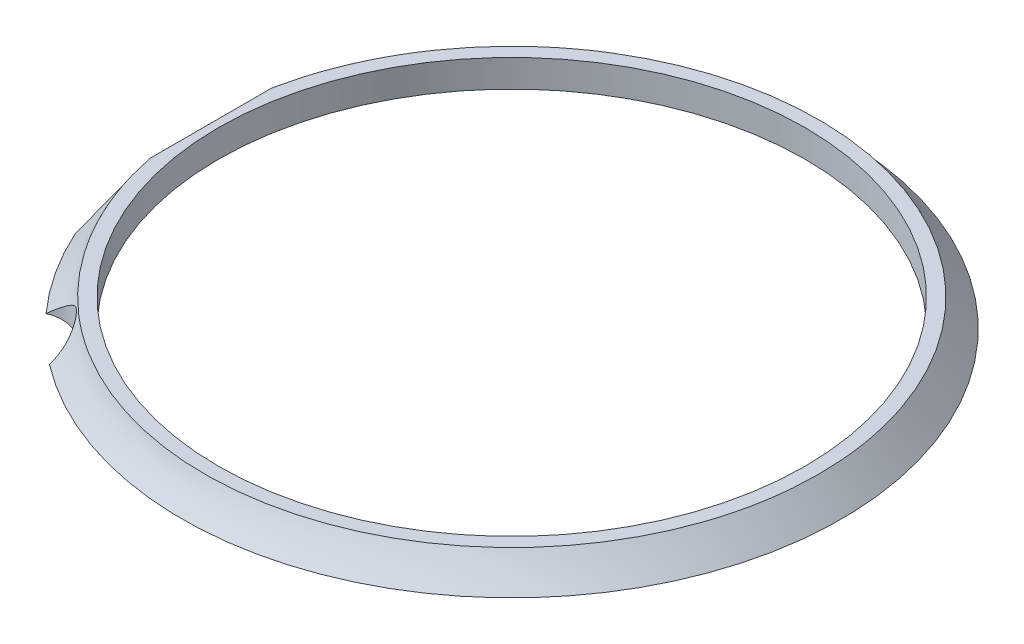
from build123d import *

# Parameters (mm, degrees)
SKETCH4_R          = 40.767
CUT_EXTRUDE2_DEPTH = 65.949295124
SKETCH5_R          = 4.75
CUT_EXTRUDE3_DEPTH = 65.949295124


with BuildPart() as part:
    # Loft2: read off the stored shape, not the designer's step
    # Loft2: loft between two sections, ruled curve by curve
    loft2_from = [
        Edge.make_bspline([(-41.825, 0, 18.778093195), (-15.942960858, 0, 76.425921217), (45.847, 0, 63.191392023), (45.847, 0, -63.191392023), (-15.942960858, 0, -76.425921217), (-41.825, 0, -18.778093195)], [0, 0, 0, 0, 0.5, 0.5, 1, 1, 1, 1], 3, [1, 0.223688408, 0.105795018, 0.105795018, 0.223688408, 1]),
        Edge.make_line((-41.825, 0, 18.778093195), (-41.825, 0, -18.778093195)),
    ]
    loft2_to = [
        Edge.make_bspline([(-41.825, 3.81, 8.459843914), (-27.786556851, 3.81, 77.865129717), (42.672, 3.81, 70.810815441), (42.672, 3.81, -70.810815441), (-27.786556851, 3.81, -77.865129717), (-41.825, 3.81, -8.459843914)], [0, 0, 0, 0, 0.5, 0.5, 1, 1, 1, 1], 3, [1, 0.159798458, 0.063879113, 0.063879113, 0.159798458, 1]),
        Edge.make_line((-41.825, 3.81, 8.459843914), (-41.825, 3.81, -8.459843914)),
    ]
    loft2 = Solid(Shell([*[Face.make_surface_from_curves(loft2_from[k], loft2_to[k]) for k in range(2)], Face(Wire(loft2_from)), Face(Wire(loft2_to))]))
    add(loft2)

    # Sketch4 → Cut-Extrude2 (cut, through all)
    with BuildSketch(Plane(origin=(0, 3.81, 0), x_dir=(1, 0, 0), z_dir=(0, 1, 0))):
        with Locations(Location((0, 0, 0), (0, 0, 270))):
            Circle(SKETCH4_R)
    extrude(amount=-CUT_EXTRUDE2_DEPTH, mode=Mode.SUBTRACT)

    # Sketch5 → Cut-Extrude3 (cut, through all)
    with BuildSketch(Plane(origin=(0, 0, 0), x_dir=(1, 0, 0), z_dir=(0, 1, 0))):
        with Locations((-32.3, -34.924987241)):
            Circle(SKETCH5_R)
        with Locations((-32.3, 34.924987241)):
            Circle(SKETCH5_R)
    extrude(amount=CUT_EXTRUDE3_DEPTH, mode=Mode.SUBTRACT)


solid = part.part
